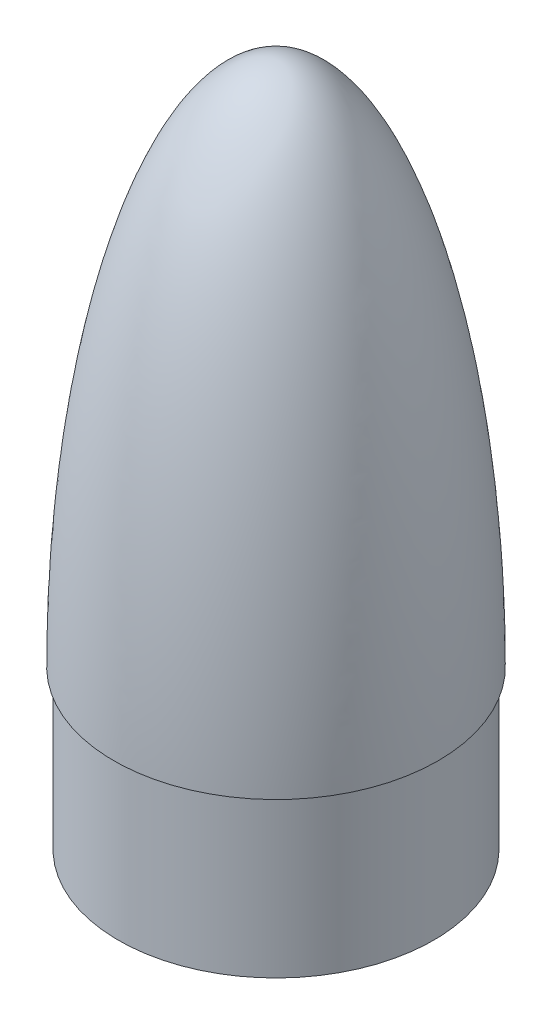
from build123d import *

# Parameters (mm, degrees)
SKETCH2_R           = 76.2
BOSS_EXTRUDE1_DEPTH = 76.2


with BuildPart() as part:
    # Sketch1 → Revolve1 (revolve)
    with BuildSketch(Plane.XY):
        with BuildLine():
            Line((78.359, 0), (0, 0))
            Line((0, 0), (0, 254))
            add(Edge.make_bspline(
                [(78.359, 0), (78.359, 0.547287489), (78.357845602, 1.649563618), (78.352650776, 3.586349875), (78.338796346, 5.988934596), (78.318010672, 8.352211569), (78.29028895, 10.745600888), (78.246958697, 13.731411826), (78.181061307, 17.311703382), (78.08386626, 21.490442467), (77.944822085, 26.264117007), (77.777683186, 31.037557631), (77.58229134, 35.809557456), (77.358460439, 40.580511863), (77.042853487, 46.542286246), (76.679080298, 52.501436144), (76.266448568, 58.457359127), (75.804102806, 64.409607399), (75.404015228, 69.168949637), (74.865626928, 75.114798701), (74.157385744, 82.243973993), (73.238266918, 90.551730955), (72.055740597, 100.030771811), (70.735528943, 109.491671534), (69.270929118, 118.931305028), (67.249996919, 130.699881306), (64.501732948, 144.763840427), (61.308555538, 158.735984092), (57.591049496, 172.577213574), (53.383025938, 186.275905479), (49.238746312, 198.044837449), (44.48323743, 209.587335711), (38.942884235, 220.71924179), (34.256173135, 228.693595393), (29.818710248, 235.095423042), (25.624249732, 240.182852143), (21.978892835, 243.926180276), (18.570150197, 246.859542723), (15.474349081, 249.076247661), (12.563405711, 250.785701438), (9.772327363, 252.083533871), (7.063069709, 253.028642362), (4.275373805, 253.686778481), (2.188006886, 253.939891173), (0.767171586, 253.999916555), (0, 254)],
                knots=[0.083290168, 0.083290168, 0.083290168, 0.083290168, 0.083290168, 0.091119674, 0.09894918, 0.106778686, 0.114608192, 0.122437698, 0.130267203, 0.145926215, 0.161585227, 0.177244239, 0.192903251, 0.208562263, 0.224221275, 0.239880287, 0.27119831, 0.286857322, 0.302516334, 0.318175346, 0.333834359, 0.365152383, 0.396470407, 0.42778843, 0.459106453, 0.490424474, 0.521742495, 0.584378539, 0.647014581, 0.678332609, 0.709650637, 0.772286631, 0.810589211, 0.841907031, 0.872607503, 0.893486158, 0.91262845, 0.928287274, 0.941044948, 0.952387223, 0.962498308, 0.97249612, 0.981348672, 0.989949856, 1, 1, 1, 1, 1], degree=4))
        make_face()
    revolve(axis=Axis((0, 254, 0), (0, -1, 0)))

    # Sketch2 → Boss-Extrude1 (add)
    with BuildSketch(Plane.XZ):
        Circle(SKETCH2_R)
    extrude(amount=BOSS_EXTRUDE1_DEPTH)


solid = part.part
